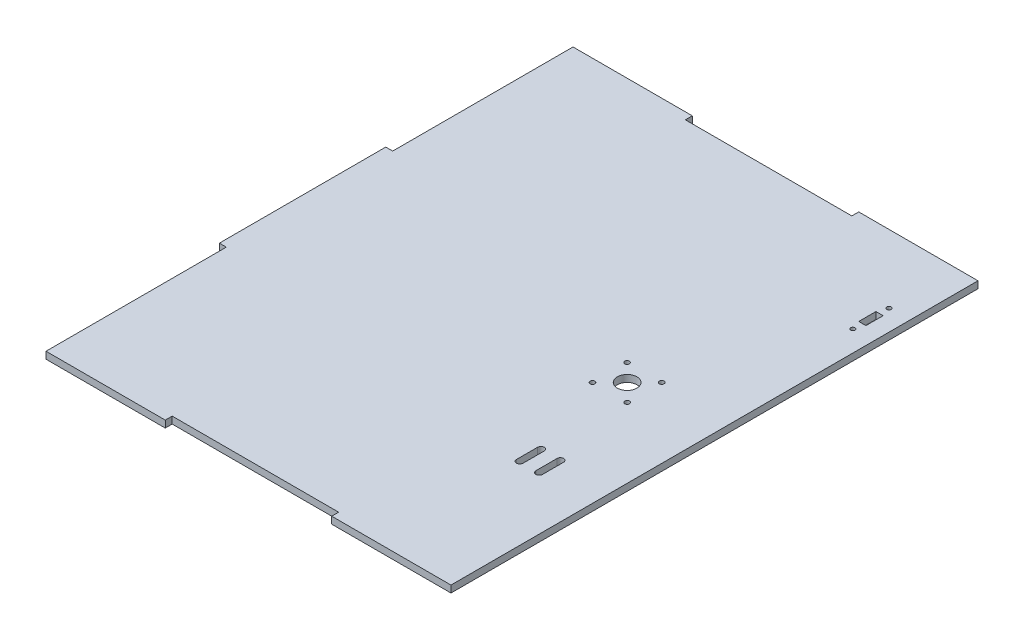
from build123d import *

# Parameters (mm, degrees)
SKETCH1_W                = 185.42
SKETCH1_H                = 241.3
BOSS_EXTRUDE1_DEPTH      = 3.175
CUT_EXTRUDE1_OUTLINE_R   = 4.49453
CUT_EXTRUDE1_OUTLINE_R_2 = 1.0922
CUT_EXTRUDE1_DEPTH       = 3.175
CUT_EXTRUDE2_DEPTH       = 305.329339737
SKETCH8_R                = 1
SKETCH8_W                = 3.302
SKETCH8_H                = 7.874
CUT_EXTRUDE4_DEPTH       = 305.329339737
SKETCH9_W                = 76.2
SKETCH9_H                = 3.175
CUT_EXTRUDE5_DEPTH       = 305.329339737
SKETCH10_W               = 3.175
SKETCH10_H               = 76.2
BOSS_EXTRUDE4_DEPTH      = 3.175


# Read off the part's stored shape, not the designer's step: Cut-Extrude1
with BuildPart() as part:
    # Sketch1 → Boss-Extrude1 (new body)
    with BuildSketch(Plane(origin=(0, 0, 0), x_dir=(1, 0, 0), z_dir=(0, 1, 0))):
        with Locations((92.71, 120.65)):
            Rectangle(SKETCH1_W, SKETCH1_H)
    extrude(amount=BOSS_EXTRUDE1_DEPTH)

    # Cut-Extrude1 outline → Cut-Extrude1 (cut)
    with BuildSketch(Plane(origin=(0, 0, 0), x_dir=(1, 0, 0), z_dir=(0, 1, 0))):
        with Locations((145.415, 120.65)):
            Circle(CUT_EXTRUDE1_OUTLINE_R)
        with Locations((153.338312588, 128.573312588)):
            Circle(CUT_EXTRUDE1_OUTLINE_R_2)
        with Locations((137.491687412, 128.573312588)):
            Circle(CUT_EXTRUDE1_OUTLINE_R_2)
        with Locations((137.491687412, 112.726687412)):
            Circle(CUT_EXTRUDE1_OUTLINE_R_2)
        with Locations((153.338312588, 112.726687412)):
            Circle(CUT_EXTRUDE1_OUTLINE_R_2)
    extrude(amount=CUT_EXTRUDE1_DEPTH, mode=Mode.SUBTRACT)

    # Sketch6 → Cut-Extrude2 (cut, through all)
    with BuildSketch(Plane(origin=(0, 3.175, 0), x_dir=(1, 0, 0), z_dir=(0, 1, 0))):
        with BuildLine():
            Line((150.615, 64.796000096), (150.615, 74.496000096))
            ThreePointArc((150.615, 74.496000096), (152.115, 75.996000096), (153.615, 74.496000096))
            Line((153.615, 74.496000096), (153.615, 64.796000096))
            ThreePointArc((153.615, 64.796000096), (152.115, 63.296000096), (150.615, 64.796000096))
        make_face()
        with BuildLine():
            Line((159.515, 64.796000096), (159.515, 74.496000096))
            ThreePointArc((159.515, 74.496000096), (161.015, 75.996000096), (162.515, 74.496000096))
            Line((162.515, 74.496000096), (162.515, 64.796000096))
            ThreePointArc((162.515, 64.796000096), (161.015, 63.296000096), (159.515, 64.796000096))
        make_face()
    extrude(amount=-CUT_EXTRUDE2_DEPTH, mode=Mode.SUBTRACT)

    # Sketch8 → Cut-Extrude4 (cut, through all)
    with BuildSketch(Plane.XZ):
        with Locations(Location((175.895, -193.548, 0), (0, 0, 270))):
            Circle(SKETCH8_R)
        with Locations(Location((175.895, -210.058, 0), (0, 0, 90))):
            Circle(SKETCH8_R)
        with Locations((175.895, -201.803)):
            Rectangle(SKETCH8_W, SKETCH8_H)
    extrude(amount=-CUT_EXTRUDE4_DEPTH, mode=Mode.SUBTRACT)

    # Sketch9 → Cut-Extrude5 (cut, through all)
    with BuildSketch(Plane(origin=(0, 3.175, 0), x_dir=(1, 0, 0), z_dir=(0, 1, 0))):
        with Locations((92.71, 239.7125)):
            Rectangle(SKETCH9_W, SKETCH9_H)
        with Locations((92.71, 1.5875)):
            Rectangle(SKETCH9_W, SKETCH9_H)
    extrude(amount=-CUT_EXTRUDE5_DEPTH, mode=Mode.SUBTRACT)

    # Sketch10 → Boss-Extrude4 (add)
    with BuildSketch(Plane(origin=(0, 3.175, 0), x_dir=(1, 0, 0), z_dir=(0, 1, 0))):
        with Locations((-1.5875, 120.65)):
            Rectangle(SKETCH10_W, SKETCH10_H)
    extrude(amount=-BOSS_EXTRUDE4_DEPTH)


solid = part.part
